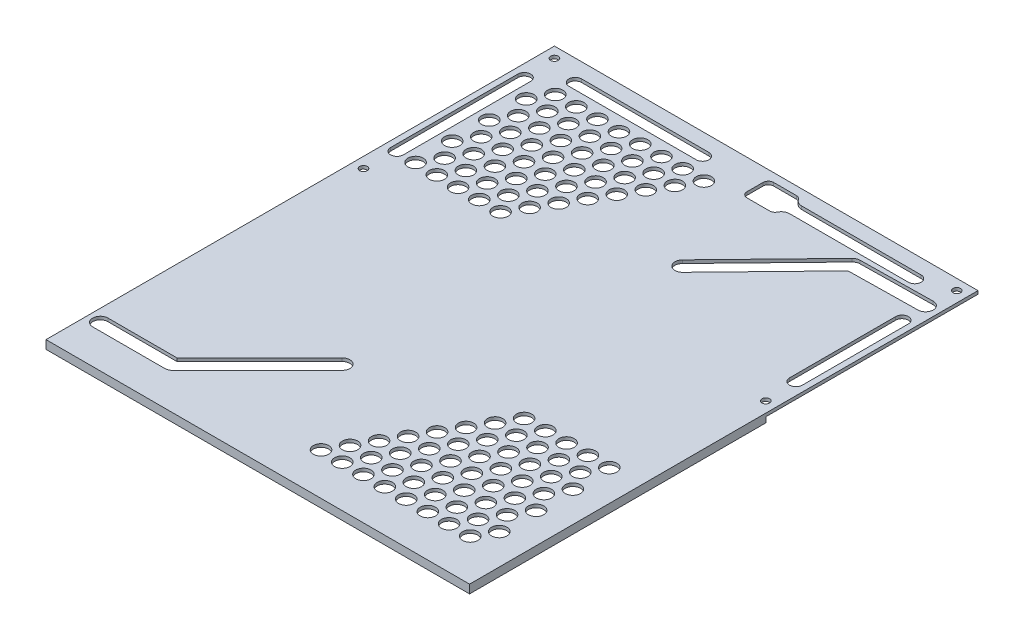
from build123d import *

# Parameters (mm, degrees)
SKETCH1_W               = 126.746
SKETCH1_H               = 152.146
BOSS_EXTRUDE1_DEPTH     = 2.54
SKETCH5_W               = 127
SKETCH5_H               = 63.5
CUT_EXTRUDE2_DEPTH      = 1.5875
CUT_EXTRUDE5_DEPTH      = 199.038898785
SKETCH10_R              = 2.286
CUT_EXTRUDE6_DEPTH      = 199.038898785
CUT_EXTRUDE7_DEPTH      = 199.038898785
CUT_EXTRUDE7_DEPTH_BACK = 199.038898785
CUT_EXTRUDE8_DEPTH      = 1.5875
CUT_EXTRUDE9_DEPTH      = 1.5875
SKETCH15_R              = 1.1303
CUT_EXTRUDE10_DEPTH     = 199.038898785
CUT_EXTRUDE11_DEPTH     = 199.038898785
CUT_EXTRUDE12_DEPTH     = 199.038898785
FILLET1_R               = 2.54


with BuildPart() as part:
    # Sketch1 → Boss-Extrude1 (new body)
    with BuildSketch(Plane(origin=(0, 0, 0), x_dir=(1, 0, 0), z_dir=(0, 1, 0))):
        with Locations((63.373, 76.073)):
            Rectangle(SKETCH1_W, SKETCH1_H)
    extrude(amount=BOSS_EXTRUDE1_DEPTH)

    # Sketch5 → Cut-Extrude2 (cut)
    with BuildSketch(Plane(origin=(0, 0, 0), x_dir=(1, 0, 0), z_dir=(0, 1, 0))):
        with Locations((63.373, 120.396)):
            Rectangle(SKETCH5_W, SKETCH5_H)
    extrude(amount=CUT_EXTRUDE2_DEPTH, mode=Mode.SUBTRACT)

    # Sketch9 → Cut-Extrude5 (cut, through all)
    with BuildSketch(Plane(origin=(0, 2.54, 0), x_dir=(1, 0, 0), z_dir=(0, 1, 0))):
        with BuildLine():
            Line((26.889446102, 10.956553898), (52.289446102, 36.356553898))
            ThreePointArc((52.289446102, 36.356553898), (52.289446102, 39.589446102), (49.056553898, 39.589446102))
            Line((49.056553898, 39.589446102), (24.326107796, 14.859))
            Line((24.326107796, 14.859), (3.683, 14.859))
            ThreePointArc((3.683, 14.859), (1.397, 12.573), (3.683, 10.287))
            Line((3.683, 10.287), (25.273, 10.287))
            ThreePointArc((25.273, 10.287), (26.147814326, 10.461011389), (26.889446102, 10.956553898))
        make_face()
        with BuildLine():
            Line((99.564745679, 141.67945316), (74.558856123, 115.891365067))
            ThreePointArc((74.558856123, 115.891365067), (74.608634933, 112.658856123), (77.841143877, 112.708634933))
            Line((77.841143877, 112.708634933), (102.18786844, 137.816938975))
            Line((102.18786844, 137.816938975), (122.828528991, 138.134793477))
            ThreePointArc((122.828528991, 138.134793477), (125.079059051, 140.455721406), (122.758131123, 142.706251466))
            Line((122.758131123, 142.706251466), (101.170690622, 142.373817088))
            ThreePointArc((101.170690622, 142.373817088), (100.298659364, 142.186356279), (99.564745679, 141.67945316))
        make_face()
    extrude(amount=-CUT_EXTRUDE5_DEPTH, mode=Mode.SUBTRACT)

    # Sketch10 → Cut-Extrude6 (cut, through all)
    with BuildSketch(Plane(origin=(0, 2.54, 0), x_dir=(1, 0, 0), z_dir=(0, 1, 0))):
        with Locations((82.423, 12.573)):
            Circle(SKETCH10_R)
        with Locations((85.600674349, 18.076893422)):
            Circle(SKETCH10_R)
        with Locations((88.778348698, 23.580786845)):
            Circle(SKETCH10_R)
        with Locations((91.956023047, 29.084680267)):
            Circle(SKETCH10_R)
        with Locations((95.133697396, 34.58857369)):
            Circle(SKETCH10_R)
        with Locations((98.311371745, 40.092467112)):
            Circle(SKETCH10_R)
        with Locations((101.489046094, 45.596360535)):
            Circle(SKETCH10_R)
        with Locations((104.666720443, 51.100253957)):
            Circle(SKETCH10_R)
        with Locations((91.997458299, 18.076893422)):
            Circle(SKETCH10_R)
        with Locations((95.175132648, 23.580786845)):
            Circle(SKETCH10_R)
        with Locations((98.352806997, 29.084680267)):
            Circle(SKETCH10_R)
        with Locations((101.530481346, 34.58857369)):
            Circle(SKETCH10_R)
        with Locations((104.708155695, 40.092467112)):
            Circle(SKETCH10_R)
        with Locations((107.885830044, 45.596360535)):
            Circle(SKETCH10_R)
        with Locations((111.063504393, 51.100253957)):
            Circle(SKETCH10_R)
        with Locations((88.81978395, 12.573)):
            Circle(SKETCH10_R)
        with Locations((98.394242248, 18.076893422)):
            Circle(SKETCH10_R)
        with Locations((101.571916597, 23.580786845)):
            Circle(SKETCH10_R)
        with Locations((104.749590946, 29.084680267)):
            Circle(SKETCH10_R)
        with Locations((107.927265295, 34.58857369)):
            Circle(SKETCH10_R)
        with Locations((111.104939644, 40.092467112)):
            Circle(SKETCH10_R)
        with Locations((114.282613993, 45.596360535)):
            Circle(SKETCH10_R)
        with Locations((117.460288342, 51.100253957)):
            Circle(SKETCH10_R)
        with Locations((95.216567899, 12.573)):
            Circle(SKETCH10_R)
        with Locations((101.683527773, 12.573)):
            Circle(SKETCH10_R)
        with Locations((104.861202122, 18.076893422)):
            Circle(SKETCH10_R)
        with Locations((108.038876471, 23.580786845)):
            Circle(SKETCH10_R)
        with Locations((111.21655082, 29.084680267)):
            Circle(SKETCH10_R)
        with Locations((114.394225169, 34.58857369)):
            Circle(SKETCH10_R)
        with Locations((117.571899518, 40.092467112)):
            Circle(SKETCH10_R)
        with Locations((108.033527773, 12.573)):
            Circle(SKETCH10_R)
        with Locations((111.211202122, 18.076893422)):
            Circle(SKETCH10_R)
        with Locations((114.388876471, 23.580786845)):
            Circle(SKETCH10_R)
        with Locations((117.56655082, 29.084680267)):
            Circle(SKETCH10_R)
        with Locations((114.383527773, 12.573)):
            Circle(SKETCH10_R)
        with Locations((117.561202122, 18.076893422)):
            Circle(SKETCH10_R)
        with Locations((44.6442865, 139.529859112)):
            Circle(SKETCH10_R)
        with Locations((41.435450281, 134.044075012)):
            Circle(SKETCH10_R)
        with Locations((38.226614062, 128.558290912)):
            Circle(SKETCH10_R)
        with Locations((35.017777843, 123.072506811)):
            Circle(SKETCH10_R)
        with Locations((31.808941625, 117.586722711)):
            Circle(SKETCH10_R)
        with Locations((28.600105406, 112.100938611)):
            Circle(SKETCH10_R)
        with Locations((25.391269187, 106.61515451)):
            Circle(SKETCH10_R)
        with Locations((22.182432968, 101.12937041)):
            Circle(SKETCH10_R)
        with Locations((35.038769196, 134.080351626)):
            Circle(SKETCH10_R)
        with Locations((31.829932977, 128.594567526)):
            Circle(SKETCH10_R)
        with Locations((28.621096758, 123.108783425)):
            Circle(SKETCH10_R)
        with Locations((25.41226054, 117.622999325)):
            Circle(SKETCH10_R)
        with Locations((22.203424321, 112.137215225)):
            Circle(SKETCH10_R)
        with Locations((18.994588102, 106.651431124)):
            Circle(SKETCH10_R)
        with Locations((15.785751883, 101.165647024)):
            Circle(SKETCH10_R)
        with Locations((38.247605415, 139.566135726)):
            Circle(SKETCH10_R)
        with Locations((28.642088111, 134.11662824)):
            Circle(SKETCH10_R)
        with Locations((25.433251892, 128.63084414)):
            Circle(SKETCH10_R)
        with Locations((22.224415673, 123.14506004)):
            Circle(SKETCH10_R)
        with Locations((19.015579455, 117.659275939)):
            Circle(SKETCH10_R)
        with Locations((15.806743236, 112.173491839)):
            Circle(SKETCH10_R)
        with Locations((12.597907017, 106.687707738)):
            Circle(SKETCH10_R)
        with Locations((9.389070798, 101.201923638)):
            Circle(SKETCH10_R)
        with Locations((31.85092433, 139.602412341)):
            Circle(SKETCH10_R)
        with Locations((25.384068449, 139.639086927)):
            Circle(SKETCH10_R)
        with Locations((22.17523223, 134.153302827)):
            Circle(SKETCH10_R)
        with Locations((18.966396011, 128.667518727)):
            Circle(SKETCH10_R)
        with Locations((15.757559793, 123.181734626)):
            Circle(SKETCH10_R)
        with Locations((12.548723574, 117.695950526)):
            Circle(SKETCH10_R)
        with Locations((9.339887355, 112.210166426)):
            Circle(SKETCH10_R)
        with Locations((19.034170561, 139.675098226)):
            Circle(SKETCH10_R)
        with Locations((15.825334342, 134.189314126)):
            Circle(SKETCH10_R)
        with Locations((12.616498123, 128.703530026)):
            Circle(SKETCH10_R)
        with Locations((9.407661905, 123.217745925)):
            Circle(SKETCH10_R)
        with Locations((12.684272673, 139.711109525)):
            Circle(SKETCH10_R)
        with Locations((9.475436454, 134.225325425)):
            Circle(SKETCH10_R)
        with Locations((76.073, 12.573)):
            Circle(SKETCH10_R)
        with Locations((79.250674349, 18.076893422)):
            Circle(SKETCH10_R)
        with Locations((82.428348698, 23.580786845)):
            Circle(SKETCH10_R)
        with Locations((85.606023047, 29.084680267)):
            Circle(SKETCH10_R)
        with Locations((88.783697396, 34.58857369)):
            Circle(SKETCH10_R)
        with Locations((91.961371745, 40.092467112)):
            Circle(SKETCH10_R)
        with Locations((95.139046094, 45.596360535)):
            Circle(SKETCH10_R)
        with Locations((98.316720443, 51.100253957)):
            Circle(SKETCH10_R)
        with Locations((69.723, 12.573)):
            Circle(SKETCH10_R)
        with Locations((72.900674349, 18.076893422)):
            Circle(SKETCH10_R)
        with Locations((76.078348698, 23.580786845)):
            Circle(SKETCH10_R)
        with Locations((79.256023047, 29.084680267)):
            Circle(SKETCH10_R)
        with Locations((82.433697396, 34.58857369)):
            Circle(SKETCH10_R)
        with Locations((85.611371745, 40.092467112)):
            Circle(SKETCH10_R)
        with Locations((88.789046094, 45.596360535)):
            Circle(SKETCH10_R)
        with Locations((91.966720443, 51.100253957)):
            Circle(SKETCH10_R)
        with Locations((28.532432968, 101.12937041)):
            Circle(SKETCH10_R)
        with Locations((31.741269187, 106.61515451)):
            Circle(SKETCH10_R)
        with Locations((34.950105406, 112.100938611)):
            Circle(SKETCH10_R)
        with Locations((38.158941625, 117.586722711)):
            Circle(SKETCH10_R)
        with Locations((41.367777843, 123.072506811)):
            Circle(SKETCH10_R)
        with Locations((44.576614062, 128.558290912)):
            Circle(SKETCH10_R)
        with Locations((47.785450281, 134.044075012)):
            Circle(SKETCH10_R)
        with Locations((50.9942865, 139.529859112)):
            Circle(SKETCH10_R)
        with Locations((34.882432968, 101.12937041)):
            Circle(SKETCH10_R)
        with Locations((38.091269187, 106.61515451)):
            Circle(SKETCH10_R)
        with Locations((41.300105406, 112.100938611)):
            Circle(SKETCH10_R)
        with Locations((44.508941625, 117.586722711)):
            Circle(SKETCH10_R)
        with Locations((47.717777843, 123.072506811)):
            Circle(SKETCH10_R)
        with Locations((50.926614062, 128.558290912)):
            Circle(SKETCH10_R)
        with Locations((54.135450281, 134.044075012)):
            Circle(SKETCH10_R)
        with Locations((57.3442865, 139.529859112)):
            Circle(SKETCH10_R)
    extrude(amount=-CUT_EXTRUDE6_DEPTH, mode=Mode.SUBTRACT)

    # Sketch12 → Cut-Extrude7 (cut, two sides: drawn at the far end of the back side and taken through both)
    with BuildSketch(Plane(origin=(0, 2.54, 0), x_dir=(1, 0, 0), z_dir=(0, 1, 0)).offset(-CUT_EXTRUDE7_DEPTH_BACK)):
        with BuildLine():
            Line((76.073, 147.701), (114.173, 147.701))
            ThreePointArc((114.173, 147.701), (116.078, 145.796), (114.173, 143.891))
            Line((114.173, 143.891), (76.073, 143.891))
            ThreePointArc((76.073, 143.891), (74.168, 145.796), (76.073, 147.701))
        make_face()
        with BuildLine():
            Line((50.673, 147.701), (12.573, 147.701))
            ThreePointArc((12.573, 147.701), (10.668, 145.796), (12.573, 143.891))
            Line((12.573, 143.891), (50.673, 143.891))
            ThreePointArc((50.673, 143.891), (52.578, 145.796), (50.673, 147.701))
        make_face()
        with BuildLine():
            Line((5.588, 139.446), (5.588, 101.346))
            ThreePointArc((5.588, 101.346), (3.683, 99.441), (1.778, 101.346))
            Line((1.778, 101.346), (1.778, 139.446))
            ThreePointArc((1.778, 139.446), (3.683, 141.351), (5.588, 139.446))
        make_face()
    extrude(amount=CUT_EXTRUDE7_DEPTH + CUT_EXTRUDE7_DEPTH_BACK, mode=Mode.SUBTRACT)

    # Sketch13 → Cut-Extrude8 (cut)
    with BuildSketch(Plane.XZ):
        with BuildLine():
            Line((23.300307909, -17.3355), (47.305403955, -41.340596045))
            ThreePointArc((47.305403955, -41.340596045), (54.040596045, -41.340596045), (54.040596045, -34.605403955))
            Line((54.040596045, -34.605403955), (28.640596045, -9.205403955))
            ThreePointArc((28.640596045, -9.205403955), (27.095529847, -8.173023726), (25.273, -7.8105))
            Line((25.273, -7.8105), (3.683, -7.8105))
            ThreePointArc((3.683, -7.8105), (-1.0795, -12.573), (3.683, -17.3355))
            Line((3.683, -17.3355), (23.300307909, -17.3355))
        make_face()
    extrude(amount=-CUT_EXTRUDE8_DEPTH, mode=Mode.SUBTRACT)

    # Sketch14 → Cut-Extrude9 (cut)
    with BuildSketch(Plane.XZ):
        with BuildLine():
            Line((65.598554014, -14.95425), (87.842274458, -53.481503957))
            ThreePointArc((87.842274458, -53.481503957), (89.585470443, -55.224699943), (91.966720443, -55.862753957))
            Line((91.966720443, -55.862753957), (117.460288342, -55.862753957))
            ThreePointArc((117.460288342, -55.862753957), (120.822735074, -54.472991455), (122.222766106, -51.11480728))
            Line((122.222766106, -51.11480728), (122.323679886, -18.091446745))
            ThreePointArc((122.323679886, -18.091446745), (122.109619013, -16.665047102), (121.478357407, -15.368148192))
            Line((121.478357407, -15.368148192), (118.636640616, -10.430002708))
            ThreePointArc((118.636640616, -10.430002708), (116.881064724, -8.517914868), (114.383527773, -7.8105))
            Line((114.383527773, -7.8105), (69.723, -7.8105))
            ThreePointArc((69.723, -7.8105), (65.598554014, -10.19175), (65.598554014, -14.95425))
        make_face()
    extrude(amount=-CUT_EXTRUDE9_DEPTH, mode=Mode.SUBTRACT)

    # Sketch15 → Cut-Extrude10 (cut, through all)
    with BuildSketch(Plane(origin=(0, 2.54, 0), x_dir=(1, 0, 0), z_dir=(0, 1, 0))):
        with Locations((3.175, 148.971)):
            Circle(SKETCH15_R)
        with Locations((3.175, 91.821)):
            Circle(SKETCH15_R)
        with Locations((123.571, 91.821)):
            Circle(SKETCH15_R)
        with Locations((123.571, 148.971)):
            Circle(SKETCH15_R)
    extrude(amount=-CUT_EXTRUDE10_DEPTH, mode=Mode.SUBTRACT)

    # Sketch16 → Cut-Extrude11 (cut, through all)
    with BuildSketch(Plane(origin=(0, 2.54, 0), x_dir=(1, 0, 0), z_dir=(0, 1, 0))):
        with BuildLine():
            Line((121.158, 101.346), (121.158, 133.096))
            ThreePointArc((121.158, 133.096), (123.063, 135.001), (124.968, 133.096))
            Line((124.968, 133.096), (124.968, 101.346))
            ThreePointArc((124.968, 101.346), (123.063, 99.441), (121.158, 101.346))
        make_face()
    extrude(amount=-CUT_EXTRUDE11_DEPTH, mode=Mode.SUBTRACT)

    # Sketch17 → Cut-Extrude12 (cut, through all)
    with BuildSketch(Plane(origin=(0, 2.54, 0), x_dir=(1, 0, 0), z_dir=(0, 1, 0))):
        with BuildLine():
            Line((74.9605, 149.606), (68.1355, 149.606))
            ThreePointArc((68.1355, 149.606), (67.012967985, 149.141032015), (66.548, 148.0185))
            Line((66.548, 148.0185), (66.548, 143.1935))
            ThreePointArc((66.548, 143.1935), (67.012967985, 142.070967985), (68.1355, 141.606))
            Line((68.1355, 141.606), (74.9605, 141.606))
            ThreePointArc((74.9605, 141.606), (76.083032015, 142.070967985), (76.548, 143.1935))
            Line((76.548, 143.1935), (76.548, 148.0185))
            ThreePointArc((76.548, 148.0185), (76.083032015, 149.141032015), (74.9605, 149.606))
        make_face()
    extrude(amount=-CUT_EXTRUDE12_DEPTH, mode=Mode.SUBTRACT)

    # Fillet1
    fillet1_edges = [part.edges().sort_by_distance(p)[0] for p in [
        (76.548, 2.06375, -147.701),
        (76.548, 2.06375, -143.891),
    ]]
    fillet(fillet1_edges, radius=FILLET1_R)


solid = part.part
